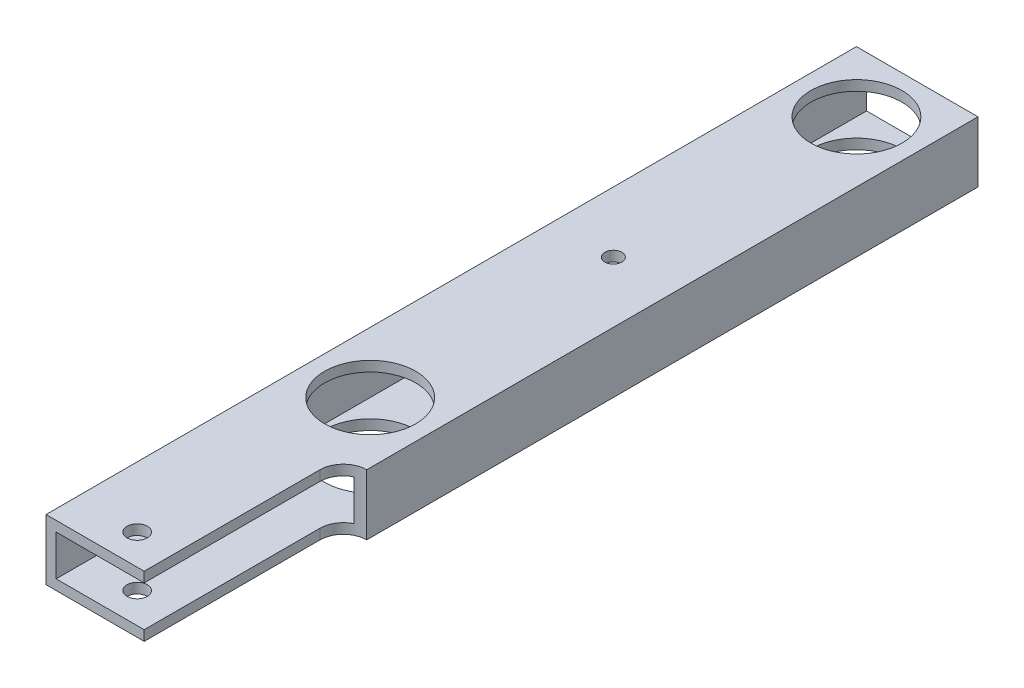
from build123d import *

# Parameters (mm, degrees)
SKETCH1_W           = 38.1
SKETCH1_H           = 19.05
SKETCH1_W_2         = 31.75
SKETCH1_H_2         = 12.7
BOSS_EXTRUDE1_DEPTH = 254
SKETCH2_R           = 14.2875
CUT_EXTRUDE1_DEPTH  = 258.547107342
SKETCH3_R           = 3.175
CUT_EXTRUDE2_DEPTH  = 258.547107342
CUT_EXTRUDE3_DEPTH  = 258.547107342
SKETCH5_R           = 2.667
CUT_EXTRUDE4_DEPTH  = 258.547107342
CUT_EXTRUDE5_REACH  = 259.547
SKETCH6_R           = 6.35


with BuildPart() as part:
    # Sketch1 → Boss-Extrude1 (new body)
    with BuildSketch(Plane.XY):
        with Locations((19.05, 9.525)):
            Rectangle(SKETCH1_W, SKETCH1_H)
        with Locations((19.05, 9.525)):
            Rectangle(SKETCH1_W_2, SKETCH1_H_2, mode=Mode.SUBTRACT)
    extrude(amount=BOSS_EXTRUDE1_DEPTH)

    # Sketch2 → Cut-Extrude1 (cut, through all)
    with BuildSketch(Plane(origin=(0, 19.05, 0), x_dir=(1, 0, 0), z_dir=(0, 1, 0))):
        with Locations((19.05, -19.05)):
            Circle(SKETCH2_R)
        with Locations((19.05, -171.45)):
            Circle(SKETCH2_R)
    extrude(amount=-CUT_EXTRUDE1_DEPTH, mode=Mode.SUBTRACT)

    # Sketch3 → Cut-Extrude2 (cut, through all)
    with BuildSketch(Plane(origin=(0, 19.05, 0), x_dir=(1, 0, 0), z_dir=(0, 1, 0))):
        with Locations((19.05, -244.475)):
            Circle(SKETCH3_R)
    extrude(amount=-CUT_EXTRUDE2_DEPTH, mode=Mode.SUBTRACT)

    # Sketch4 → Cut-Extrude3 (cut, through all)
    with BuildSketch(Plane(origin=(0, 19.05, 0), x_dir=(1, 0, 0), z_dir=(0, 1, 0))):
        with BuildLine():
            Line((30.774464213, -254), (30.774464213, -198.91983478))
            ThreePointArc((30.774464213, -198.91983478), (32.920063969, -193.739898749), (38.1, -191.594298992))
            Line((38.1, -191.594298992), (38.1, -254))
            Line((38.1, -254), (30.774464213, -254))
        make_face()
    extrude(amount=-CUT_EXTRUDE3_DEPTH, mode=Mode.SUBTRACT)

    # Sketch5 → Cut-Extrude4 (cut, through all)
    with BuildSketch(Plane(origin=(0, 19.05, 0), x_dir=(1, 0, 0), z_dir=(0, 1, 0))):
        with Locations((19.05, -95.25)):
            Circle(SKETCH5_R)
    extrude(amount=-CUT_EXTRUDE4_DEPTH, mode=Mode.SUBTRACT)

    # Sketch6 → Cut-Extrude5 (cut, up to next)
    with BuildSketch(Plane.XZ, mode=Mode.PRIVATE) as cut_extrude5_sk1:
        with Locations((19.05, 95.25)):
            Circle(SKETCH6_R)
    cut_extrude5_tool1 = extrude(cut_extrude5_sk1.sketch, amount=-CUT_EXTRUDE5_REACH, mode=Mode.PRIVATE) & part.part
    add(cut_extrude5_tool1.solids().sort_by_distance((19.05, 0, 95.25))[0], mode=Mode.SUBTRACT)


solid = part.part
